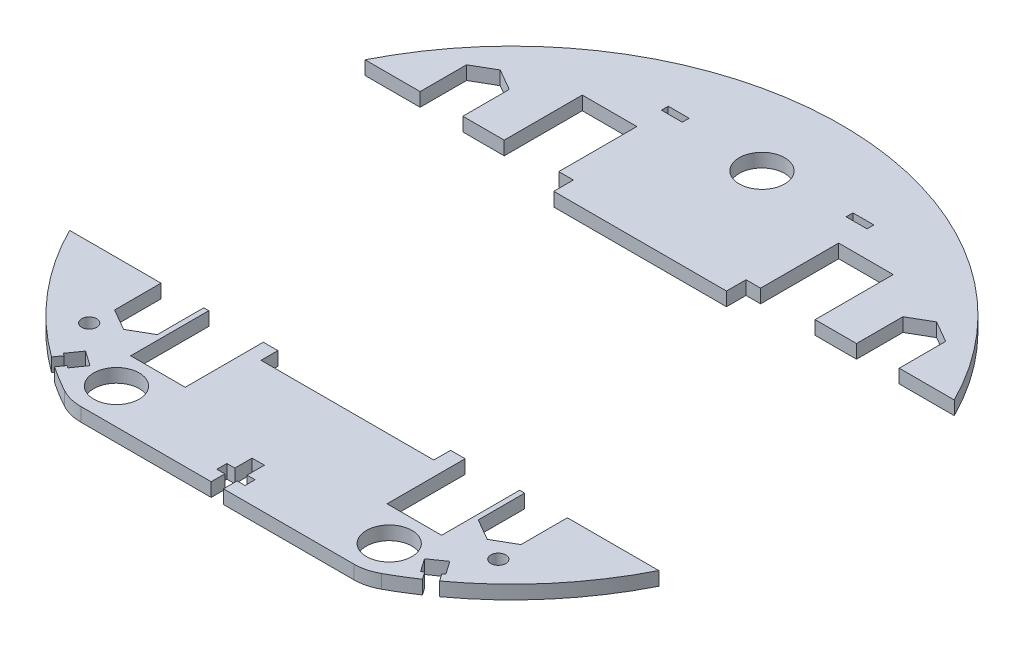
from build123d import *

# Parameters (mm, degrees)
BOSS_EXTRUDE1_DEPTH = 3
CUT_EXTRUDE1_DEPTH  = 103.574363269
SKETCH3_W           = 38.3
SKETCH3_H           = 65
CUT_EXTRUDE2_DEPTH  = 103.574363269
SKETCH4_R           = 5
CUT_EXTRUDE3_DEPTH  = 98.289516393
CUT_EXTRUDE4_DEPTH  = 98.289516393
SKETCH6_W           = 4.6
SKETCH6_H           = 1.5
CUT_EXTRUDE5_DEPTH  = 98.289516393
SKETCH7_R           = 5
CUT_EXTRUDE6_DEPTH  = 98.289516393
CUT_EXTRUDE7_DEPTH  = 98.289516393
SKETCH9_R           = 1.65
CUT_EXTRUDE8_DEPTH  = 98.289516393
CUT_EXTRUDE9_DEPTH  = 98.289516393


with BuildPart() as part:
    # Sketch1 → Boss-Extrude1 (new body)
    with BuildSketch(Plane(origin=(0, 0, 0), x_dir=(1, 0, 0), z_dir=(0, 1, 0))):
        with BuildLine():
            Line((-30.029977361, -64.812867647), (30.029977361, -64.812867647))
            ThreePointArc((30.029977361, -64.812867647), (32.509837414, -64.500503794), (34.834773739, -63.582926471))
            ThreePointArc((34.834773739, -63.582926471), (0, 72.5), (-34.834773739, -63.582926471))
            ThreePointArc((-34.834773739, -63.582926471), (-32.509837414, -64.500503794), (-30.029977361, -64.812867647))
        make_face()
    extrude(amount=BOSS_EXTRUDE1_DEPTH)

    # Sketch2 → Cut-Extrude1 (cut, through all)
    with BuildSketch(Plane(origin=(0, 3, 0), x_dir=(1, 0, 0), z_dir=(0, 1, 0))):
        Polygon((-34.2, 49.675685802), (-34.2, -49.675685802), (-22.2, -49.675685802), (-22.2, -32.5), (-19, -32.5), (-19, -36.2), (-18, -36.2), (18, -36.2), (19, -36.2), (19, -32.5), (22.2, -32.5), (22.2, -49.675685802), (34.2, -49.675685802), (34.2, 49.675685802), (22.2, 49.675685802), (22.2, 32.5), (19, 32.5), (19, 28.2), (-19, 28.2), (-19, 32.5), (-22.2, 32.5), (-22.2, 49.675685802), align=None)
    extrude(amount=-CUT_EXTRUDE1_DEPTH, mode=Mode.SUBTRACT)

    # Sketch3 → Cut-Extrude2 (cut, through all)
    with BuildSketch(Plane(origin=(0, 3, 0), x_dir=(1, 0, 0), z_dir=(0, 1, 0))):
        with Locations((-53.35, 0)):
            Rectangle(SKETCH3_W, SKETCH3_H)
        with Locations((53.35, 0)):
            Rectangle(SKETCH3_W, SKETCH3_H)
    extrude(amount=-CUT_EXTRUDE2_DEPTH, mode=Mode.SUBTRACT)


with BuildPart() as cut_extrude2_piece_1:
    # of the separate pieces the step leaves, piece 1, a body of its own (cut_extrude2_pieces)
    add(part.part.solids().sort_by_distance((64.807406984, 0, -32.5))[0])


with BuildPart() as cut_extrude2_piece_2:
    # of the separate pieces the step leaves, piece 2, a body of its own (cut_extrude2_pieces)
    add(part.part.solids().sort_by_distance((-34.834773739, 0, 63.582926471))[0])

    # Sketch4 → Cut-Extrude3 (cut, through all)
    with BuildSketch(Plane(origin=(0, 3, 0), x_dir=(1, 0, 0), z_dir=(0, 1, 0))):
        with Locations((30, -57)):
            Circle(SKETCH4_R)
        with Locations((-30, -57)):
            Circle(SKETCH4_R)
    extrude(amount=-CUT_EXTRUDE3_DEPTH, mode=Mode.SUBTRACT)


with BuildPart() as cut_extrude4_tool:
    # Sketch5 → Cut-Extrude4 (new, through all)
    with BuildSketch(Plane(origin=(0, 3, 0), x_dir=(1, 0, 0), z_dir=(0, 1, 0))):
        Polygon((-52.7, 37.286453735), (-52.7, 32.5), (-43.3, 32.5), (-43.3, 37.286453735), (-43.3, 42.713546265), (-48, 45.42709253), (-52.7, 42.713546265), align=None)
        Polygon((-44.7, -37.286453735), (-44.7, -32.5), (-35.3, -32.5), (-35.3, -37.286453735), (-35.3, -42.713546265), (-40, -45.42709253), (-44.7, -42.713546265), align=None)
        Polygon((35.3, -32.5), (44.7, -32.5), (44.7, -37.286453735), (44.7, -42.713546265), (40, -45.42709253), (35.3, -42.713546265), (35.3, -37.286453735), align=None)
        Polygon((43.3, 37.286453735), (43.3, 42.713546265), (48, 45.42709253), (52.7, 42.713546265), (52.7, 37.286453735), (52.7, 32.5), (43.3, 32.5), align=None)
    extrude(amount=-CUT_EXTRUDE4_DEPTH)


with BuildPart() as cut_extrude2_piece_1_1:
    add(cut_extrude2_piece_1.part)

    # Cut-Extrude4: cut by cut_extrude4_tool
    add(cut_extrude4_tool.part, mode=Mode.SUBTRACT)

    # Sketch6 → Cut-Extrude5 (cut, through all)
    with BuildSketch(Plane(origin=(0, 3, 0), x_dir=(1, 0, 0), z_dir=(0, 1, 0))):
        with Locations((-20.32, 56.25)):
            Rectangle(SKETCH6_W, SKETCH6_H)
        with Locations((20.32, 56.25)):
            Rectangle(SKETCH6_W, SKETCH6_H)
    extrude(amount=-CUT_EXTRUDE5_DEPTH, mode=Mode.SUBTRACT)

    # Sketch7 → Cut-Extrude6 (cut, through all)
    with BuildSketch(Plane(origin=(0, 3, 0), x_dir=(1, 0, 0), z_dir=(0, 1, 0))):
        with Locations((0, 55)):
            Circle(SKETCH7_R)
    extrude(amount=-CUT_EXTRUDE6_DEPTH, mode=Mode.SUBTRACT)


with BuildPart() as cut_extrude2_piece_2_1:
    add(cut_extrude2_piece_2.part)

    # Cut-Extrude4: cut by cut_extrude4_tool
    add(cut_extrude4_tool.part, mode=Mode.SUBTRACT)

    # Sketch8 → Cut-Extrude7 (cut, through all)
    with BuildSketch(Plane(origin=(0, 3, 0), x_dir=(1, 0, 0), z_dir=(0, 1, 0))):
        Polygon((-1.35, -64.812867647), (-1.35, -61.812867647), (-3.1, -61.812867647), (-3.1, -59.612867647), (-1.35, -59.612867647), (-1.35, -55.812867647), (1.35, -55.812867647), (1.35, -59.612867647), (3.1, -59.612867647), (3.1, -61.812867647), (1.35, -61.812867647), (1.35, -64.812867647), align=None)
    extrude(amount=-CUT_EXTRUDE7_DEPTH, mode=Mode.SUBTRACT)

    # Sketch9 → Cut-Extrude8 (cut, through all)
    with BuildSketch(Plane(origin=(0, 3, 0), x_dir=(1, 0, 0), z_dir=(0, 1, 0))):
        with Locations((45, -48)):
            Circle(SKETCH9_R)
        with Locations((-45, -48)):
            Circle(SKETCH9_R)
    extrude(amount=-CUT_EXTRUDE8_DEPTH, mode=Mode.SUBTRACT)

    # Sketch10 → Cut-Extrude9 (cut, through all)
    with BuildSketch(Plane(origin=(0, 3, 0), x_dir=(1, 0, 0), z_dir=(0, 1, 0))):
        Polygon((36.791317147, -56.03033984), (40.067925324, -53.736034095), (42.075442851, -56.60306625), (41.542994023, -56.975890933), (42.690146895, -58.614195022), (40.478436376, -60.1628514), (39.331283503, -58.524547311), (38.798834674, -58.897371995), align=None)
        Polygon((-41.542994023, -56.975890933), (-42.075442851, -56.60306625), (-40.067925324, -53.736034095), (-36.791317147, -56.03033984), (-38.798834674, -58.897371995), (-39.331283503, -58.524547311), (-40.478436376, -60.1628514), (-42.690146895, -58.614195022), align=None)
    extrude(amount=-CUT_EXTRUDE9_DEPTH, mode=Mode.SUBTRACT)


solid = Compound([cut_extrude2_piece_1_1.part, cut_extrude2_piece_2_1.part])
